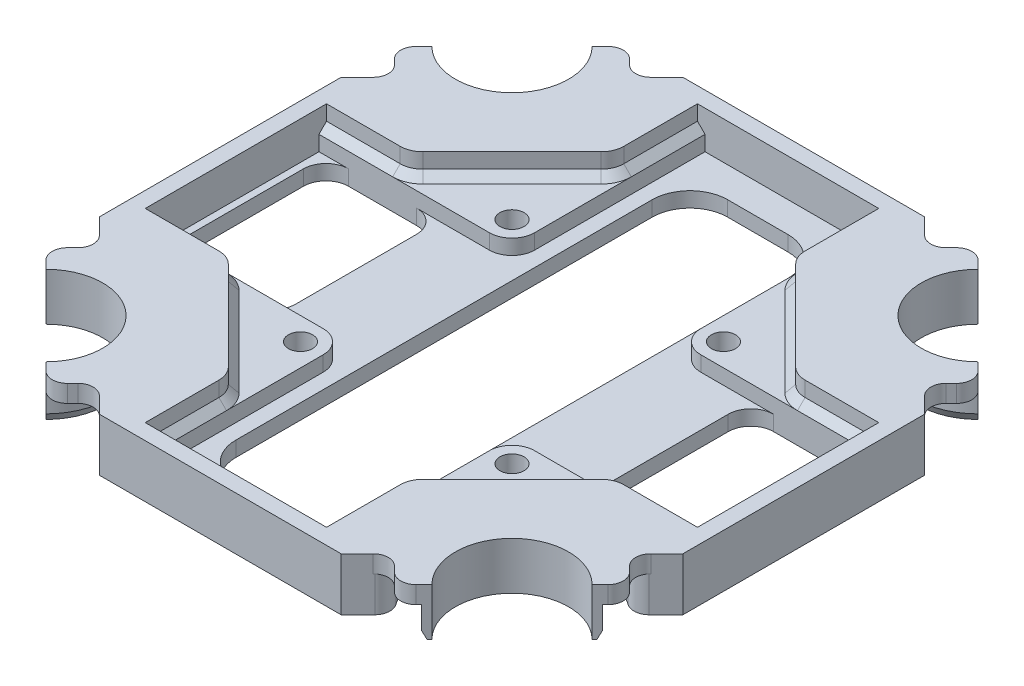
from build123d import *
from OCP.BRepFilletAPI import BRepFilletAPI_MakeChamfer
from build123d.topology import SkipClean

# Parameters (mm, degrees)
BOSS_EXTRUDE1_DEPTH = 7
BOSS_EXTRUDE2_DEPTH = 2.3
CUT_EXTRUDE1_DEPTH  = 10
BOSS_EXTRUDE3_DEPTH = 4
CUT_EXTRUDE2_START  = -4
SKETCH5_R           = 7.5
CUT_EXTRUDE2_DEPTH  = 4
CHAMFER1_SIZE       = 1
CHAMFER1_SIZE2      = 0.5
FILLET1_R           = 2
FILLET2_R           = 2
SKETCH6_W           = 22
SKETCH6_H           = 10
SKETCH6_W_2         = 10
SKETCH6_H_2         = 22
CUT_EXTRUDE3_DEPTH  = 5
SKETCH7_R           = 1.6
CUT_EXTRUDE4_DEPTH  = 5
CUT_EXTRUDE5_DEPTH  = 22
FILLET4_R           = 5
FILLET5_R           = 3
BOSS_EXTRUDE6_START = 2
SKETCH9_R           = 1.6
BOSS_EXTRUDE6_DEPTH = 2
CUT_EXTRUDE6_DEPTH  = 3
FILLET6_R           = 3
CHAMFER3_SIZE       = 1


# Some blends are built 0.0001 mm under size
with BuildPart() as part:
    # Sketch1 → Boss-Extrude1 (new body)
    with BuildSketch(Plane(origin=(0, 0, 0), x_dir=(1, 0, 0), z_dir=(0, 1, 0))):
        Polygon((38.627417, 16), (16, 38.627417), (-16, 38.627417), (-38.627417, 16), (-38.627417, -16), (-16, -38.627417), (16, -38.627417), (38.627417, -16), align=None)
    extrude(amount=BOSS_EXTRUDE1_DEPTH)

    # Sketch2 → Boss-Extrude2 (add)
    with BuildSketch(Plane(origin=(0, 7, 0), x_dir=(1, 0, 0), z_dir=(0, 1, 0))):
        Polygon((-38.625708, 23.069359), (-35.091883, 19.535534), (-19.535534, 35.091883), (-23.069359, 38.625708), align=None)
        Polygon((35.091883, 19.535534), (38.625708, 23.069359), (23.069359, 38.625708), (19.535534, 35.091883), align=None)
        Polygon((38.625708, -23.069359), (35.091883, -19.535534), (19.535534, -35.091883), (23.069359, -38.625708), align=None)
        Polygon((-23.069359, -38.625708), (-19.535534, -35.091883), (-35.091883, -19.535534), (-38.625708, -23.069359), align=None)
    extrude(amount=-BOSS_EXTRUDE2_DEPTH)

    # Sketch3 → Cut-Extrude1 (cut)
    with BuildSketch(Plane.XZ.offset(-4.7)):
        with BuildLine():
            ThreePointArc((-19.535534, 35.091883), (-35.091883, 35.091883), (-35.091883, 19.535534))
            Line((-35.091883, 19.535534), (-19.535534, 35.091883))
        make_face()
        with BuildLine():
            Line((-19.535534, 35.091883), (-35.091883, 19.535534))
            ThreePointArc((-35.091883, 19.535534), (-23.104191, 17.151034), (-16.313708, 27.313708))
            ThreePointArc((-16.313708, 27.313708), (-17.151034, 31.523226), (-19.535534, 35.091883))
        make_face()
        with BuildLine():
            ThreePointArc((38.313708, 27.313708), (31.523226, 37.476383), (19.535534, 35.091883))
            Line((19.535534, 35.091883), (35.091883, 19.535534))
            ThreePointArc((35.091883, 19.535534), (37.476383, 23.104191), (38.313708, 27.313708))
        make_face()
        with BuildLine():
            Line((35.091883, 19.535534), (19.535534, 35.091883))
            ThreePointArc((19.535534, 35.091883), (19.535534, 19.535534), (35.091883, 19.535534))
        make_face()
        with BuildLine():
            ThreePointArc((38.313708, -27.313708), (37.476383, -23.104191), (35.091883, -19.535534))
            Line((35.091883, -19.535534), (19.535534, -35.091883))
            ThreePointArc((19.535534, -35.091883), (31.523226, -37.476383), (38.313708, -27.313708))
        make_face()
        with BuildLine():
            Line((19.535534, -35.091883), (35.091883, -19.535534))
            ThreePointArc((35.091883, -19.535534), (19.535534, -19.535534), (19.535534, -35.091883))
        make_face()
        with BuildLine():
            ThreePointArc((-35.091883, -19.535534), (-35.091883, -35.091883), (-19.535534, -35.091883))
            Line((-19.535534, -35.091883), (-35.091883, -19.535534))
        make_face()
        with BuildLine():
            Line((-35.091883, -19.535534), (-19.535534, -35.091883))
            ThreePointArc((-19.535534, -35.091883), (-17.151034, -31.523226), (-16.313708, -27.313708))
            ThreePointArc((-16.313708, -27.313708), (-23.104191, -17.151034), (-35.091883, -19.535534))
        make_face()
    extrude(amount=CUT_EXTRUDE1_DEPTH, mode=Mode.SUBTRACT)

    # Sketch4 → Boss-Extrude3 (add)
    with BuildSketch(Plane(origin=(0, 4.7, 0), x_dir=(-1, 0, 0), z_dir=(0, -1, 0))):
        with BuildLine():
            Line((24.872481, -36.822586), (25.544232, -36.150834))
            ThreePointArc((25.544232, -36.150834), (25.544232, -25.544232), (36.150834, -25.544232))
            Line((36.150834, -25.544232), (36.822586, -24.872481))
            ThreePointArc((36.822586, -24.872481), (24.872481, -24.872481), (24.872481, -36.822586))
        make_face()
        with BuildLine():
            Line((-36.822586, -24.872481), (-36.150834, -25.544232))
            ThreePointArc((-36.150834, -25.544232), (-25.544232, -25.544232), (-25.544232, -36.150834))
            Line((-25.544232, -36.150834), (-24.872481, -36.822586))
            ThreePointArc((-24.872481, -36.822586), (-24.872481, -24.872481), (-36.822586, -24.872481))
        make_face()
        with BuildLine():
            Line((-24.872481, 36.822586), (-25.544232, 36.150834))
            ThreePointArc((-25.544232, 36.150834), (-25.544232, 25.544232), (-36.150834, 25.544232))
            Line((-36.150834, 25.544232), (-36.822586, 24.872481))
            ThreePointArc((-36.822586, 24.872481), (-24.872481, 24.872481), (-24.872481, 36.822586))
        make_face()
        with BuildLine():
            Line((36.822586, 24.872481), (36.150834, 25.544232))
            ThreePointArc((36.150834, 25.544232), (25.544232, 25.544232), (25.544232, 36.150834))
            Line((25.544232, 36.150834), (24.872481, 36.822586))
            ThreePointArc((24.872481, 36.822586), (24.872481, 24.872481), (36.822586, 24.872481))
        make_face()
    extrude(amount=BOSS_EXTRUDE3_DEPTH)

    # Sketch5 → Cut-Extrude2 (cut)
    with SkipClean():  # the faces are left unmerged after this step: merging them gives an invalid solid
        with BuildSketch(Plane(origin=(0, 4.7, 0), x_dir=(-1, 0, 0), z_dir=(0, -1, 0)).offset(CUT_EXTRUDE2_START)):
            with Locations((30.847533, -30.847533)):
                Circle(SKETCH5_R)
            with Locations((-30.847533, -30.847533)):
                Circle(SKETCH5_R)
            with Locations((-30.847533, 30.847533)):
                Circle(SKETCH5_R)
            with Locations((30.847533, 30.847533)):
                Circle(SKETCH5_R)
        extrude(amount=CUT_EXTRUDE2_DEPTH, mode=Mode.SUBTRACT)

    # Chamfer1: one chamfer whose edges measure the first distance from different faces: ONE call of the kernel's chamfer builder (chamfer() names one face for all edges)
    chamfer1_edges_1 = [part.edges().sort_by_distance(p)[0] for p in [
        (-24.872481, 0.7, 24.872481),
    ]]
    chamfer1_side_1 = [part.faces().sort_by_distance(p)[0] for p in [
        (-24.872481, 2.7, 24.872481),
    ]]
    chamfer1_edges_2 = [part.edges().sort_by_distance(p)[0] for p in [
        (24.872481, 0.7, 24.872481),
    ]]
    chamfer1_side_2 = [part.faces().sort_by_distance(p)[0] for p in [
        (24.872481, 2.7, 24.872481),
    ]]
    chamfer1_edges_3 = [part.edges().sort_by_distance(p)[0] for p in [
        (24.872481, 0.7, -24.872481),
    ]]
    chamfer1_side_3 = [part.faces().sort_by_distance(p)[0] for p in [
        (24.872481, 2.7, -24.872481),
    ]]
    chamfer1_edges_4 = [part.edges().sort_by_distance(p)[0] for p in [
        (-24.872481, 0.7, -24.872481),
    ]]
    chamfer1_side_4 = [part.faces().sort_by_distance(p)[0] for p in [
        (-24.872481, 2.7, -24.872481),
    ]]
    chamfer1 = BRepFilletAPI_MakeChamfer(part.part.solid().wrapped)
    for e in chamfer1_edges_1:
        chamfer1.Add(CHAMFER1_SIZE, CHAMFER1_SIZE2, e.wrapped, chamfer1_side_1[0].wrapped)  # the first distance lies on this face
    for e in chamfer1_edges_2:
        chamfer1.Add(CHAMFER1_SIZE, CHAMFER1_SIZE2, e.wrapped, chamfer1_side_2[0].wrapped)  # the first distance lies on this face
    for e in chamfer1_edges_3:
        chamfer1.Add(CHAMFER1_SIZE, CHAMFER1_SIZE2, e.wrapped, chamfer1_side_3[0].wrapped)  # the first distance lies on this face
    for e in chamfer1_edges_4:
        chamfer1.Add(CHAMFER1_SIZE, CHAMFER1_SIZE2, e.wrapped, chamfer1_side_4[0].wrapped)  # the first distance lies on this face
    add(Compound.cast(chamfer1.Shape()), mode=Mode.REPLACE)

    # Fillet1
    fillet1_edges = [part.edges().sort_by_distance(p)[0] for p in [
        (-38.625708, 5.85, -23.069359),
        (-23.069359, 5.85, -38.625708),
        (-19.535534, 5.85, -35.091883),
        (-35.091883, 5.85, -19.535534),
        (23.069359, 5.85, -38.625708),
        (38.625708, 5.85, -23.069359),
        (35.091883, 5.85, -19.535534),
        (19.535534, 5.85, -35.091883),
        (23.069359, 5.85, 38.625708),
        (19.535534, 5.85, 35.091883),
        (35.091883, 5.85, 19.535534),
        (38.625708, 5.85, 23.069359),
        (-38.625708, 5.85, 23.069359),
        (-35.091883, 5.85, 19.535534),
        (-19.535534, 5.85, 35.091883),
        (-23.069359, 5.85, 38.625708),
    ]]
    fillet(fillet1_edges, radius=FILLET1_R)

    # Fillet2
    fillet2_edges = [part.edges().sort_by_distance(p)[0] for p in [
        (-19.535534, 2.35, 35.091883),
        (-35.091883, 2.35, 19.535534),
        (-35.091883, 2.35, -19.535534),
        (-19.535534, 2.35, -35.091883),
        (19.535534, 2.35, -35.091883),
        (35.091883, 2.35, -19.535534),
        (35.091883, 2.35, 19.535534),
        (19.535534, 2.35, 35.091883),
    ]]
    fillet(fillet2_edges, radius=FILLET2_R)

    # Sketch6 → Cut-Extrude3 (cut)
    with SkipClean():  # the faces are left unmerged after this step: merging them gives an invalid solid
        with BuildSketch(Plane(origin=(0, 7, 0), x_dir=(1, 0, 0), z_dir=(0, 1, 0))):
            Polygon((11, -26.556349), (26.556349, -11), (26.556349, 11), (11, 26.556349), (-11, 26.556349), (-26.556349, 11), (-26.556349, -11), (-11, -26.556349), align=None)
            with Locations((0, 31.556349)):
                Rectangle(SKETCH6_W, SKETCH6_H)
            with Locations((-31.556349, 0)):
                Rectangle(SKETCH6_W_2, SKETCH6_H_2)
            with Locations((0, -31.556349)):
                Rectangle(SKETCH6_W, SKETCH6_H)
            with Locations((31.556349, 0)):
                Rectangle(SKETCH6_W_2, SKETCH6_H_2)
        extrude(amount=-CUT_EXTRUDE3_DEPTH, mode=Mode.SUBTRACT)

    # Sketch7 → Cut-Extrude4 (cut)
    with SkipClean():  # the faces are left unmerged after this step: merging them gives an invalid solid
        with BuildSketch(Plane(origin=(0, 2, 0), x_dir=(1, 0, 0), z_dir=(0, 1, 0))):
            with Locations(Location((-14, 14, 0), (0, 0, 270))):
                Circle(SKETCH7_R)
            with Locations(Location((14, 14, 0), (0, 0, 270))):
                Circle(SKETCH7_R)
            with Locations(Location((14, -14, 0), (0, 0, 270))):
                Circle(SKETCH7_R)
            with Locations(Location((-14, -14, 0), (0, 0, 270))):
                Circle(SKETCH7_R)
        extrude(amount=-CUT_EXTRUDE4_DEPTH, mode=Mode.SUBTRACT)

    # Sketch8 → Cut-Extrude5 (cut)
    with SkipClean():  # the faces are left unmerged after this step: merging them gives an invalid solid
        with BuildSketch(Plane(origin=(0, 2, 0), x_dir=(1, 0, 0), z_dir=(0, 1, 0))):
            Polygon((35.627417, -11), (35.627417, 2), (35.627417, 11), (20.627417, 11), (20.627417, -11), align=None)
            Polygon((-9, -32.556349), (0, -32.556349), (0, 32.556349), (-9, 32.556349), (-9, 18.556349), (-9, -22.556349), align=None)
            Polygon((0, 32.556349), (0, -32.556349), (9, -32.556349), (9, -20.556349), (9, 20.556349), (9, 32.556349), align=None)
            Polygon((-35.627417, -11), (-20.627417, -11), (-20.627417, 11), (-35.627417, 11), (-35.627417, 2), align=None)
        extrude(amount=-CUT_EXTRUDE5_DEPTH, mode=Mode.SUBTRACT)

    # Fillet4
    fillet4_edges = [part.edges().sort_by_distance(p)[0] for p in [
        (9, 1, 32.556349),
        (-9, 1, 32.556349),
        (-9, 1, -32.556349),
        (9, 1, -32.556349),
    ]]
    fillet(fillet4_edges, radius=FILLET4_R)

    # Fillet5
    # the kernel refuses this fillet: 3 mm, written as the material it adds along each edge
    with BuildSketch(Plane(origin=(-20.627417, 2, 11), x_dir=(-1, 0, 0), z_dir=(0, -1, 0)), Plane(origin=(-35.627417, 2, -11), x_dir=(1, 0, 0), z_dir=(0, -1, 0)), Plane(origin=(-20.627417, 2, -11), x_dir=(0, 0, 1), z_dir=(0, -1, 0)), Plane(origin=(20.627417, 2, 11), x_dir=(0, 0, -1), z_dir=(0, -1, 0)), Plane(origin=(20.627417, 2, -11), x_dir=(1, 0, 0), z_dir=(0, -1, 0)), Plane(origin=(35.627417, 2, -11), x_dir=(0, 0, 1), z_dir=(0, -1, 0))) as fillet5_piece_1:
        with BuildLine():
            CenterArc((FILLET5_R, FILLET5_R), FILLET5_R, 180, 90)
            Line((0, FILLET5_R), (0, 0))
            Line((0, 0), (FILLET5_R, 0))
        make_face()
    extrude(amount=2)
    with BuildSketch(Plane(origin=(-35.627417, 2, 11), x_dir=(1, 0, 0), z_dir=(0, -1, 0)), Plane(origin=(35.627417, 2, 11), x_dir=(0, 0, -1), z_dir=(0, -1, 0))) as fillet5_piece_2:
        with BuildLine():
            CenterArc((FILLET5_R, -FILLET5_R), FILLET5_R, 90, 90)
            Line((0, -FILLET5_R), (0, 0))
            Line((0, 0), (FILLET5_R, 0))
        make_face()
    extrude(amount=2)

    # Sketch9 → Boss-Extrude6 (add)
    # profile 1 of 4: a face of its own
    with SkipClean():  # the faces are left unmerged after this step: merging them gives an invalid solid
        with BuildSketch(Plane(origin=(0, 2, 0), x_dir=(1, 0, 0), z_dir=(0, 1, 0)).offset(BOSS_EXTRUDE6_START)):
            with BuildLine():
                Line((-28.213203, 11), (-14, 11))
                ThreePointArc((-14, 11), (-11.87868, 11.87868), (-11, 14))
                Line((-11, 14), (-11, 28.213203))
                Line((-11, 28.213203), (-16.38809, 22.825113))
                Line((-16.38809, 22.825113), (-16.206293, 21.350057))
                Line((-16.206293, 21.350057), (-21.064872, 16.491477))
                Line((-21.064872, 16.491477), (-22.688831, 16.524372))
                Line((-22.688831, 16.524372), (-28.213203, 11))
            make_face()
            with Locations(Location((-14, 14, 0), (0, 0, 270))):
                Circle(SKETCH9_R, mode=Mode.SUBTRACT)
        # profile 2 of 4: a face of its own
        with BuildSketch(Plane(origin=(0, 2, 0), x_dir=(1, 0, 0), z_dir=(0, 1, 0)).offset(BOSS_EXTRUDE6_START)):
            with BuildLine():
                Line((11, 28.213203), (11, 14))
                ThreePointArc((11, 14), (11.87868, 11.87868), (14, 11))
                Line((14, 11), (28.213203, 11))
                Line((28.213203, 11), (22.825113, 16.38809))
                Line((22.825113, 16.38809), (21.350057, 16.206293))
                Line((21.350057, 16.206293), (16.491477, 21.064872))
                Line((16.491477, 21.064872), (16.524372, 22.688831))
                Line((16.524372, 22.688831), (11, 28.213203))
            make_face()
            with Locations(Location((14, 14, 0), (0, 0, 270))):
                Circle(SKETCH9_R, mode=Mode.SUBTRACT)
        # profile 3 of 4: a face of its own
        with BuildSketch(Plane(origin=(0, 2, 0), x_dir=(1, 0, 0), z_dir=(0, 1, 0)).offset(BOSS_EXTRUDE6_START)):
            with BuildLine():
                Line((28.213203, -11), (14, -11))
                ThreePointArc((14, -11), (11.87868, -11.87868), (11, -14))
                Line((11, -14), (11, -28.213203))
                Line((11, -28.213203), (16.38809, -22.825113))
                Line((16.38809, -22.825113), (16.206293, -21.350057))
                Line((16.206293, -21.350057), (21.064872, -16.491477))
                Line((21.064872, -16.491477), (22.688831, -16.524372))
                Line((22.688831, -16.524372), (28.213203, -11))
            make_face()
            with Locations(Location((14, -14, 0), (0, 0, 270))):
                Circle(SKETCH9_R, mode=Mode.SUBTRACT)
        # profile 4 of 4: a face of its own
        with BuildSketch(Plane(origin=(0, 2, 0), x_dir=(1, 0, 0), z_dir=(0, 1, 0)).offset(BOSS_EXTRUDE6_START)):
            with BuildLine():
                Line((-11, -28.213203), (-11, -14))
                ThreePointArc((-11, -14), (-11.87868, -11.87868), (-14, -11))
                Line((-14, -11), (-28.213203, -11))
                Line((-28.213203, -11), (-22.825113, -16.38809))
                Line((-22.825113, -16.38809), (-21.350057, -16.206293))
                Line((-21.350057, -16.206293), (-16.491477, -21.064872))
                Line((-16.491477, -21.064872), (-16.524372, -22.688831))
                Line((-16.524372, -22.688831), (-11, -28.213203))
            make_face()
            with Locations(Location((-14, -14, 0), (0, 0, 270))):
                Circle(SKETCH9_R, mode=Mode.SUBTRACT)
        extrude(amount=-BOSS_EXTRUDE6_DEPTH)

    # Sketch12 → Cut-Extrude6 (cut)
    with SkipClean():  # the faces are left unmerged after this step: merging them gives an invalid solid
        with BuildSketch(Plane(origin=(0, 7, 0), x_dir=(1, 0, 0), z_dir=(0, 1, 0))):
            Polygon((-36.556349, 0), (-36.556349, 12), (-12, 12), (-12, 36.556349), (0, 36.556349), (12, 36.556349), (12, 12), (36.556349, 12), (36.556349, 0), (36.556349, -12), (12, -12), (12, -36.556349), (0, -36.556349), (-12, -36.556349), (-12, -12), (-36.556349, -12), align=None)
        extrude(amount=-CUT_EXTRUDE6_DEPTH, mode=Mode.SUBTRACT)

    # Fillet6
    fillet6_edges = [part.edges().sort_by_distance(p)[0] for p in [
        (-25.556349, 5.5, -12),
        (-12, 5.5, -25.556349),
        (12, 5.5, -25.556349),
        (25.556349, 5.5, -12),
        (25.556349, 5.5, 12),
        (12, 5.5, 25.556349),
        (-12, 5.5, 25.556349),
        (-25.556349, 5.5, 12),
    ]]
    fillet(fillet6_edges, radius=FILLET6_R)

    # Chamfer3
    chamfer3_edges = [part.edges().sort_by_distance(p)[0] for p in [
        (-31.67767, 4, 12),
        (-12, 4, 31.67767),
        (12, 4, 31.67767),
        (31.67767, 4, 12),
        (12, 4, -31.67767),
        (12.228361, 4, -25.65094),
        (18.920767, 4, -18.635582),
        (25.65094, 4, -12.228361),
        (31.67767, 4, -12),
        (-12, 4, -31.67767),
        (-12.228361, 4, -25.65094),
        (-18.635582, 4, -18.920767),
        (-25.65094, 4, -12.228361),
        (-31.67767, 4, -12),
        (-25.65094, 4, 12.228361),
        (-18.920767, 4, 18.635582),
        (-12.228361, 4, 25.65094),
        (12.228361, 4, 25.65094),
        (18.635582, 4, 18.920767),
        (25.65094, 4, 12.228361),
    ]]
    chamfer(chamfer3_edges, length=CHAMFER3_SIZE - 0.0001)  # a hair under: the kernel refuses the full size


solid = part.part
